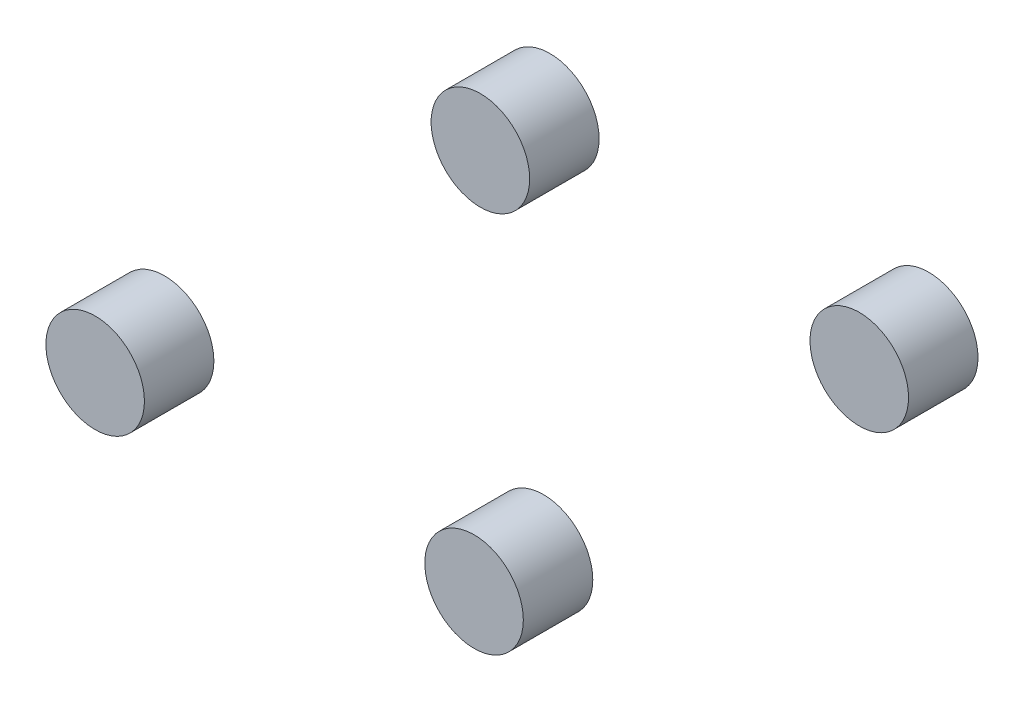
from build123d import *

# Parameters (mm, degrees)
BOSS_EXTRUDE1_START   = 228.6
SKETCH1_R             = 49.53
BOSS_EXTRUDE1_DEPTH   = 69.85
BOSS_EXTRUDE1_2_DEPTH = 69.85


with BuildPart() as part:
    # Sketch1 → Boss-Extrude1 (new body)
    with BuildSketch(Plane.XY.offset(BOSS_EXTRUDE1_START)):
        with Locations((-190.5, 0)):
            Circle(SKETCH1_R)
    extrude(amount=-BOSS_EXTRUDE1_DEPTH)


with BuildPart() as body_2:
    # Sketch1 → Boss-Extrude1 2 (new body)
    with BuildSketch(Plane.XY.offset(BOSS_EXTRUDE1_START)):
        with Locations((190.5, 0)):
            Circle(SKETCH1_R)
    extrude(amount=-BOSS_EXTRUDE1_2_DEPTH)


with BuildPart() as body_3:
    # Mirror3: mirrored copy
    add(part.part.mirror(Plane.XY))


with BuildPart() as body_4:
    # Mirror3 2: mirrored copy
    add(body_2.part.mirror(Plane.XY))


solid = Compound([part.part, body_2.part, body_3.part, body_4.part])
